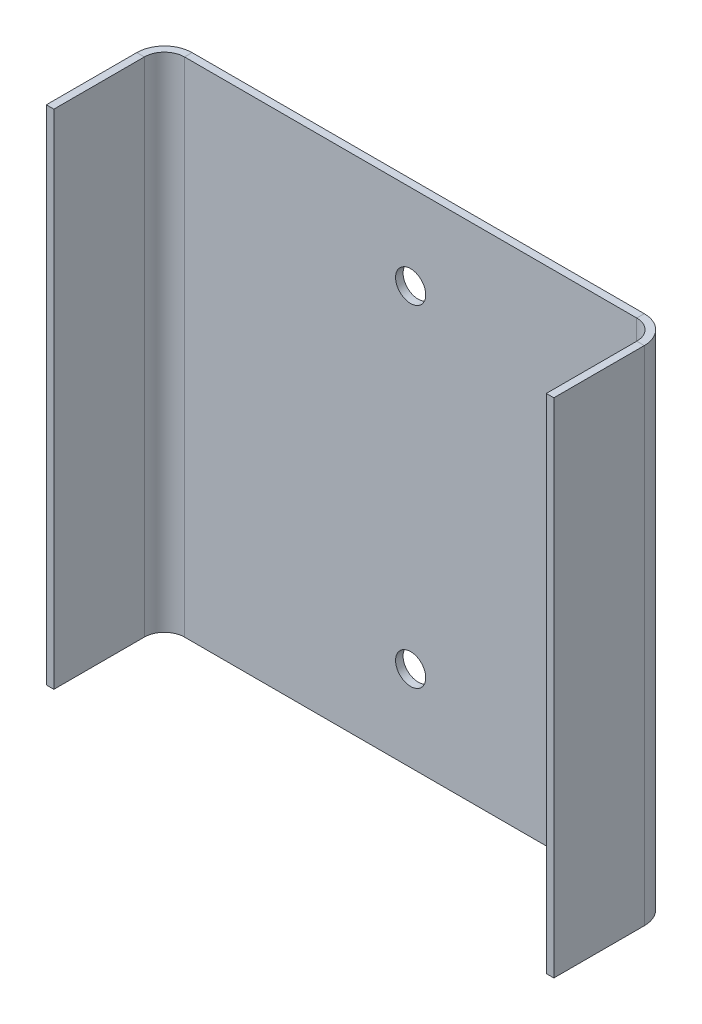
from build123d import *

# Parameters (mm, degrees)
SKETCH1_W                = 90
SKETCH1_H                = 100
BOSS_EXTRUDE1_DEPTH      = 10
CONVERT_SOLID1_START     = 1.5
CONVERT_SOLID1_OUTLINE_W = 90
CONVERT_SOLID1_OUTLINE_H = 100
CONVERT_SOLID1_DEPTH     = 8.5
EDGE_FLANGE1_DEPTH       = 100
EDGE_FLANGE2_DEPTH       = 100
SKETCH12_R               = 3
CUT_EXTRUDE1_DEPTH       = 75.849849699


# Read off the part's stored shape, not the designer's step: Convert-Solid1
# Sheet-metal steps are written as plain solids
with BuildPart() as part:
    # Sketch1 → Boss-Extrude1 (new body)
    with BuildSketch(Plane.XY):
        Rectangle(SKETCH1_W, SKETCH1_H)
    extrude(amount=BOSS_EXTRUDE1_DEPTH)

    # Convert-Solid1 outline → Convert-Solid1 (cut)
    with BuildSketch(Plane.XY.offset(CONVERT_SOLID1_START)):
        Rectangle(CONVERT_SOLID1_OUTLINE_W, CONVERT_SOLID1_OUTLINE_H)
    extrude(amount=CONVERT_SOLID1_DEPTH, mode=Mode.SUBTRACT)

    # Edge-Flange1 section (across the edge) → Edge-Flange1 (add)
    with BuildSketch(Plane(origin=(-49, 50, 1.5), x_dir=(1, 0, 0), z_dir=(0, -1, 0))):
        with BuildLine():
            Line((-1.5, 4), (-1.5, 22))
            Line((-1.5, 22), (0, 22))
            Line((0, 22), (0, 4))
            ThreePointArc((0, 4), (1.171572875, 1.171572875), (4, 0))
            Line((4, 0), (4, -1.5))
            ThreePointArc((4, -1.5), (0.110912703, 0.110912703), (-1.5, 4))
        make_face()
    extrude(amount=EDGE_FLANGE1_DEPTH)

    # Edge-Flange2 section (across the edge) → Edge-Flange2 (add)
    with BuildSketch(Plane(origin=(49, -50, 1.5), x_dir=(-1, 0, 0), z_dir=(0, 1, 0))):
        with BuildLine():
            Line((-1.5, 4), (-1.5, 22))
            Line((-1.5, 22), (0, 22))
            Line((0, 22), (0, 4))
            ThreePointArc((0, 4), (1.171572875, 1.171572875), (4, 0))
            Line((4, 0), (4, -1.5))
            ThreePointArc((4, -1.5), (0.110912703, 0.110912703), (-1.5, 4))
        make_face()
    extrude(amount=EDGE_FLANGE2_DEPTH)

    # Sketch12 → Cut-Extrude1 (cut, through all)
    with BuildSketch(Plane(origin=(0, 0, 0), x_dir=(-1, 0, 0), z_dir=(0, 0, -1))):
        with Locations((0, 33)):
            Circle(SKETCH12_R)
        with Locations((0, -33)):
            Circle(SKETCH12_R)
    extrude(amount=-CUT_EXTRUDE1_DEPTH, mode=Mode.SUBTRACT)


solid = part.part
